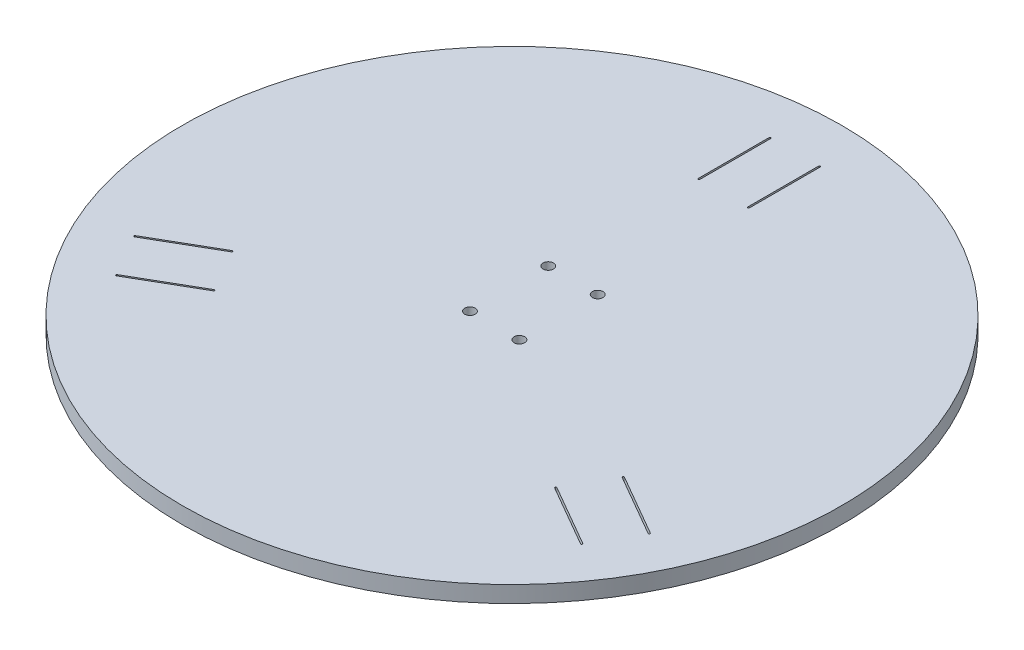
from build123d import *

# Parameters (mm, degrees)
SKETCH2_R                            = 100
BOSS_EXTRUDE1_DEPTH                  = 5
SKETCH3_W                            = 0.5
SKETCH3_H                            = 22
CUT_EXTRUDE1_DEPTH                   = 142.509716981
F_3_2_3_2_DIAMETER_HOLE1_D           = 3.2
F_3_2_3_2_DIAMETER_HOLE1_CSINK_D     = 3.25
F_3_2_3_2_DIAMETER_HOLE1_CSINK_ANGLE = 90
FILLET1_R                            = 0.2


with BuildPart() as part:
    # Sketch2 → Boss-Extrude1 (new body)
    with BuildSketch(Plane(origin=(0, 0, 0), x_dir=(1, 0, 0), z_dir=(0, 1, 0))):
        Circle(SKETCH2_R)
    extrude(amount=BOSS_EXTRUDE1_DEPTH)

    # Sketch3 → Cut-Extrude1 (cut, through all)
    with BuildSketch(Plane(origin=(0, 5, 0), x_dir=(1, 0, 0), z_dir=(0, 1, 0))):
        with Locations((-7.5, 75)):
            Rectangle(SKETCH3_W, SKETCH3_H)
        with Locations((7.5, 75)):
            Rectangle(SKETCH3_W, SKETCH3_H)
        Polygon((59.300625842, -25.288303121), (78.353184725, -36.288303121), (78.103184725, -36.721315823), (59.050625842, -25.721315823), align=None)
        Polygon((51.800625842, -38.278684177), (70.853184725, -49.278684177), (70.603184725, -49.711696879), (51.550625842, -38.711696879), align=None)
        Polygon((-51.550625842, -38.711696879), (-70.603184725, -49.711696879), (-70.853184725, -49.278684177), (-51.800625842, -38.278684177), align=None)
        Polygon((-59.050625842, -25.721315823), (-78.103184725, -36.721315823), (-78.353184725, -36.288303121), (-59.300625842, -25.288303121), align=None)
    extrude(amount=-CUT_EXTRUDE1_DEPTH, mode=Mode.SUBTRACT)

    # Ø3.2 (3.2) Diameter Hole1 (through all)
    with Locations(Plane(origin=(0, 0, 0), x_dir=(-1, 0, 0), z_dir=(0, -1, 0))):
        with Locations((-7.5, 18.5), (7.5, 18.5), (7.5, -5.25), (-7.5, -5.25)):
            CounterSinkHole(F_3_2_3_2_DIAMETER_HOLE1_D / 2, F_3_2_3_2_DIAMETER_HOLE1_CSINK_D / 2, counter_sink_angle=F_3_2_3_2_DIAMETER_HOLE1_CSINK_ANGLE)

    # Fillet1
    fillet1_edges = [part.edges().sort_by_distance(p)[0] for p in [
        (59.050625842, 2.5, 25.721315823),
        (59.300625842, 2.5, 25.288303121),
        (78.353184725, 2.5, 36.288303121),
        (78.103184725, 2.5, 36.721315823),
        (-59.300625842, 2.5, 25.288303121),
        (-59.050625842, 2.5, 25.721315823),
        (-78.103184725, 2.5, 36.721315823),
        (-78.353184725, 2.5, 36.288303121),
        (-51.800625842, 2.5, 38.278684177),
        (-51.550625842, 2.5, 38.711696879),
        (-70.603184725, 2.5, 49.711696879),
        (-70.853184725, 2.5, 49.278684177),
        (51.550625842, 2.5, 38.711696879),
        (51.800625842, 2.5, 38.278684177),
        (70.853184725, 2.5, 49.278684177),
        (70.603184725, 2.5, 49.711696879),
        (7.25, 2.5, -64),
        (7.25, 2.5, -86),
        (7.75, 2.5, -86),
        (7.75, 2.5, -64),
        (-7.75, 2.5, -64),
        (-7.25, 2.5, -86),
        (-7.25, 2.5, -64),
        (-7.75, 2.5, -86),
    ]]
    fillet(fillet1_edges, radius=FILLET1_R)


solid = part.part
